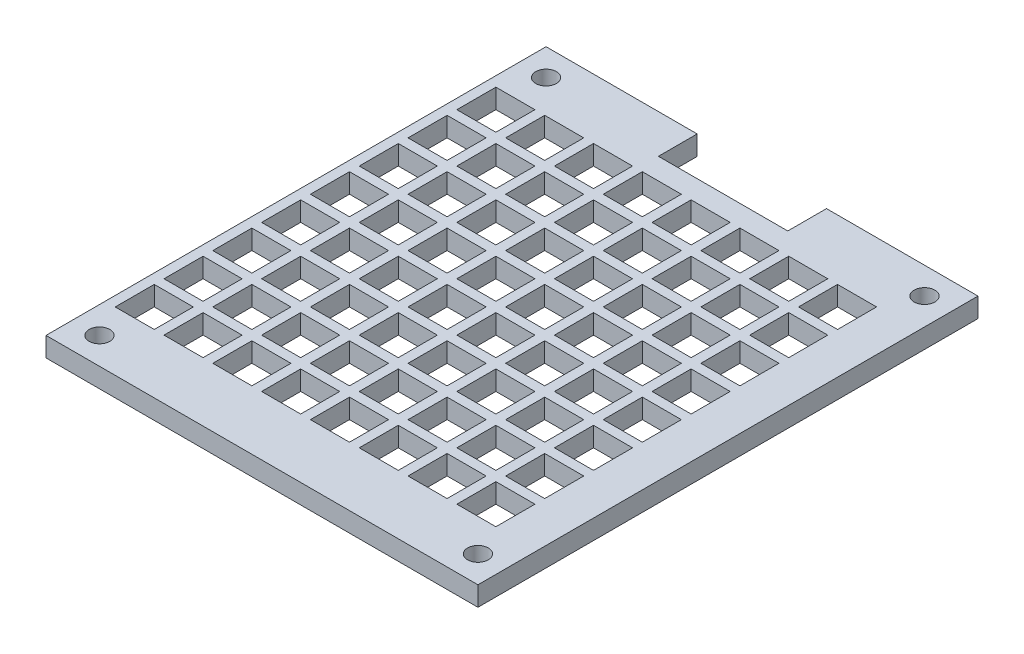
from build123d import *

# Parameters (mm, degrees)
SKETCH1_R            = 1.3462
BOSS_EXTRUDE1_DEPTH  = 2.54
SKETCH2_W            = 5.08
SKETCH2_H            = 5.08
CUT_EXTRUDE1_DEPTH   = 87.00981027
LPATTERN1_COUNT      = 8
LPATTERN1_PITCH      = 6.35
LPATTERN1_COUNT_DIR2 = 8
LPATTERN1_PITCH_DIR2 = 6.35


with BuildPart() as part:
    # Sketch1 → Boss-Extrude1 (new body)
    with BuildSketch(Plane(origin=(0, 0, 0), x_dir=(1, 0, 0), z_dir=(0, 1, 0))):
        Polygon((56.1975, 65.0621), (36.4871, 65.0621), (36.4871, 60.0202), (19.6596, 60.0202), (19.6596, 65.0621), (0, 65.0621), (0, 0), (56.1975, 0), align=None)
        with Locations((3.4798, 3.4798)):
            Circle(SKETCH1_R, mode=Mode.SUBTRACT)
        with Locations((52.7177, 3.4798)):
            Circle(SKETCH1_R, mode=Mode.SUBTRACT)
        with Locations((3.4798, 61.5823)):
            Circle(SKETCH1_R, mode=Mode.SUBTRACT)
        with Locations((52.7177, 61.5823)):
            Circle(SKETCH1_R, mode=Mode.SUBTRACT)
    extrude(amount=BOSS_EXTRUDE1_DEPTH)

    # Sketch2 → Cut-Extrude1 (cut, through all)
    with BuildSketch(Plane(origin=(0, 2.54, 0), x_dir=(1, 0, 0), z_dir=(0, 1, 0))):
        with Locations((3.8354, 54.6989)):
            Rectangle(SKETCH2_W, SKETCH2_H)
    cut_extrude1 = extrude(amount=-CUT_EXTRUDE1_DEPTH, mode=Mode.SUBTRACT)

    # LPattern1: Cut-Extrude1 8 × 8
    with Locations(*[(i * LPATTERN1_PITCH, 0, j * LPATTERN1_PITCH_DIR2) for i in range(LPATTERN1_COUNT) for j in range(LPATTERN1_COUNT_DIR2) if (i, j) != (0, 0)]):
        add(cut_extrude1, mode=Mode.SUBTRACT)


solid = part.part
